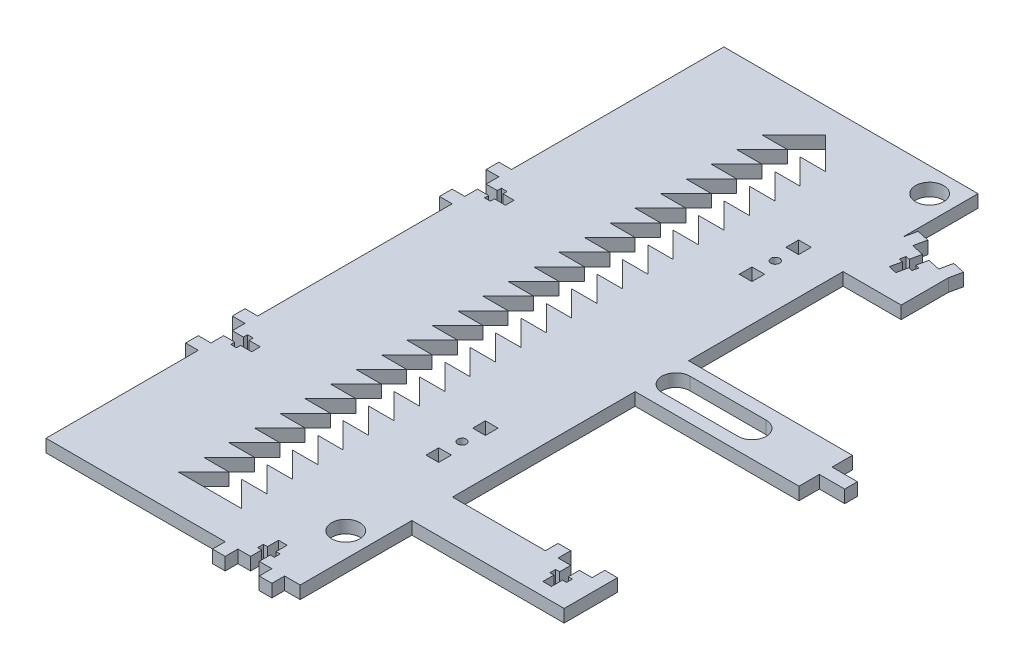
from build123d import *

# Parameters (mm, degrees)
AXLE_SUPPORT_PLATE_W   = 6.35
AXLE_SUPPORT_PLATE_H   = 6.35
AXLE_SUPPORT_PLATE_R   = 2.159
AXLE_SUPPORT_PLATE_R_2 = 7.030128061
BOSS_EXTRUDE1_DEPTH    = 6.35
BOSS_EXTRUDE2_DEPTH    = 6.35


with BuildPart() as part:
    # Axle Support Plate → Boss-Extrude1 (new body)
    with BuildSketch(Plane(origin=(0, 0, 0), x_dir=(1, 0, 0), z_dir=(0, 1, 0))):
        Polygon((55.79393597, -169.56756403), (63.58606403, -169.56756403), (63.58606403, -113.68756403), (139.78606403, -113.68756403), (139.78606403, -93.36756403), (139.78606403, -87.01756403), (133.43606403, -87.01756403), (133.43606403, -93.36756403), (127.08606403, -93.36756403), (127.08606403, -98.902564009), (129.127064012, -98.902564009), (129.127064012, -101.802564051), (127.08606403, -101.802564051), (127.08606403, -107.33756403), (122.76806403, -107.33756403), (122.76806403, -101.802564051), (120.727064048, -101.802564051), (120.727064048, -98.902564009), (122.76806403, -98.902564009), (122.76806403, -93.36756403), (116.41806403, -93.36756403), (116.41806403, -87.01756403), (110.06806403, -87.01756403), (110.06806403, -93.36756403), (63.58606403, -93.36756403), (63.58606403, -1.972692091), (145.546192091, -1.972692091), (145.546192091, 8.23243597), (158.246192091, 8.23243597), (158.246192091, 14.58243597), (145.546192091, 14.58243597), (145.546192091, 24.78756403), (63.58606403, 24.78756403), (63.58606403, 169.56756403), (-63.58606403, 169.56756403), (-63.58606403, 63.35043597), (-69.93606403, 63.35043597), (-69.93606403, 57.00043597), (-63.58606403, 57.00043597), (-63.58606403, 50.65043597), (-58.051064051, 50.65043597), (-58.051064051, 52.691435952), (-55.151064009, 52.691435952), (-55.151064009, 50.65043597), (-49.61606403, 50.65043597), (-49.61606403, 46.33243597), (-55.151064009, 46.33243597), (-55.151064009, 44.291435988), (-58.051064051, 44.291435988), (-58.051064051, 46.33243597), (-63.58606403, 46.33243597), (-63.58606403, 39.98243597), (-69.93606403, 39.98243597), (-69.93606403, 33.63243597), (-63.58606403, 33.63243597), (-63.58606403, -63.64956403), (-69.93606403, -63.64956403), (-69.93606403, -69.99956403), (-63.58606403, -69.99956403), (-63.58606403, -76.34956403), (-58.051064051, -76.34956403), (-58.051064051, -74.308564048), (-55.151064009, -74.308564048), (-55.151064009, -76.34956403), (-49.61606403, -76.34956403), (-49.61606403, -80.66756403), (-55.151064009, -80.66756403), (-55.151064009, -82.708564012), (-58.051064051, -82.708564012), (-58.051064051, -80.66756403), (-63.58606403, -80.66756403), (-63.58606403, -87.01756403), (-69.93606403, -87.01756403), (-69.93606403, -93.36756403), (-63.58606403, -93.36756403), (-63.58606403, -169.56756403), (26.07593597, -169.56756403), (26.07593597, -175.91756403), (32.42593597, -175.91756403), (32.42593597, -169.56756403), (38.77593597, -169.56756403), (38.77593597, -164.032564051), (36.734935988, -164.032564051), (36.734935988, -161.132564009), (38.77593597, -161.132564009), (38.77593597, -155.59756403), (43.09393597, -155.59756403), (43.09393597, -161.132564009), (45.134935952, -161.132564009), (45.134935952, -164.032564051), (43.09393597, -164.032564051), (43.09393597, -169.56756403), (49.44393597, -169.56756403), (49.44393597, -175.91756403), (55.79393597, -175.91756403), align=None)
        with Locations((41.95093597, -78.63556403)):
            Rectangle(AXLE_SUPPORT_PLATE_W, AXLE_SUPPORT_PLATE_H, mode=Mode.SUBTRACT)
        with Locations((41.95093597, -66.95156403)):
            Circle(AXLE_SUPPORT_PLATE_R, mode=Mode.SUBTRACT)
        with Locations((41.95093597, -55.26756403)):
            Rectangle(AXLE_SUPPORT_PLATE_W, AXLE_SUPPORT_PLATE_H, mode=Mode.SUBTRACT)
        with Locations((51.47593597, -134.64256403)):
            Circle(AXLE_SUPPORT_PLATE_R_2, mode=Mode.SUBTRACT)
        Polygon((-15.875, 140.99256403), (0, 156.86756403), (15.875, 140.99256403), (3.175, 140.99256403), (15.875, 128.29256403), (3.175, 128.29256403), (15.875, 115.59256403), (3.175, 115.59256403), (15.875, 102.89256403), (3.175, 102.89256403), (15.875, 90.19256403), (3.175, 90.19256403), (15.875, 77.49256403), (3.175, 77.49256403), (15.875, 64.79256403), (3.175, 64.79256403), (15.875, 52.09256403), (3.175, 52.09256403), (15.875, 39.39256403), (3.175, 39.39256403), (15.875, 26.69256403), (3.175, 26.69256403), (15.875, 13.99256403), (3.175, 13.99256403), (15.875, 1.29256403), (3.175, 1.29256403), (15.875, -11.40743597), (3.175, -11.40743597), (15.875, -24.10743597), (3.175, -24.10743597), (15.875, -36.80743597), (3.175, -36.80743597), (15.875, -49.50743597), (3.175, -49.50743597), (15.875, -62.20743597), (3.175, -62.20743597), (15.875, -74.90743597), (3.175, -74.90743597), (15.875, -87.60743597), (3.175, -87.60743597), (15.875, -100.30743597), (3.175, -100.30743597), (15.875, -113.00743597), (3.175, -113.00743597), (15.875, -125.70743597), (3.175, -125.70743597), (15.875, -138.40743597), (3.175, -138.40743597), (15.875, -151.10743597), (-15.875, -151.10743597), (-3.175, -138.40743597), (-15.875, -138.40743597), (-3.175, -125.70743597), (-15.875, -125.70743597), (-3.175, -113.00743597), (-15.875, -113.00743597), (-3.175, -100.30743597), (-15.875, -100.30743597), (-3.175, -87.60743597), (-15.875, -87.60743597), (-3.175, -74.90743597), (-15.875, -74.90743597), (-3.175, -62.20743597), (-15.875, -62.20743597), (-3.175, -49.50743597), (-15.875, -49.50743597), (-3.175, -36.80743597), (-15.875, -36.80743597), (-3.175, -24.10743597), (-15.875, -24.10743597), (-3.175, -11.40743597), (-15.875, -11.40743597), (-3.175, 1.29256403), (-15.875, 1.29256403), (-3.175, 13.99256403), (-15.875, 13.99256403), (-3.175, 26.69256403), (-15.875, 26.69256403), (-3.175, 39.39256403), (-15.875, 39.39256403), (-3.175, 52.09256403), (-15.875, 52.09256403), (-3.175, 64.79256403), (-15.875, 64.79256403), (-3.175, 77.49256403), (-15.875, 77.49256403), (-3.175, 90.19256403), (-15.875, 90.19256403), (-3.175, 102.89256403), (-15.875, 102.89256403), (-3.175, 115.59256403), (-15.875, 115.59256403), (-3.175, 128.29256403), (-15.875, 128.29256403), (-3.175, 140.99256403), align=None, mode=Mode.SUBTRACT)
        with Locations((41.95093597, 78.08243597)):
            Rectangle(AXLE_SUPPORT_PLATE_W, AXLE_SUPPORT_PLATE_H, mode=Mode.SUBTRACT)
        with Locations((41.95093597, 89.76643597)):
            Circle(AXLE_SUPPORT_PLATE_R, mode=Mode.SUBTRACT)
        with Locations((41.95093597, 101.45043597)):
            Rectangle(AXLE_SUPPORT_PLATE_W, AXLE_SUPPORT_PLATE_H, mode=Mode.SUBTRACT)
        with BuildLine():
            ThreePointArc((70.616192091, 4.377307909), (63.58606403, 11.40743597), (70.616192091, 18.43756403))
            Line((70.616192091, 18.43756403), (108.716192091, 18.43756403))
            ThreePointArc((108.716192091, 18.43756403), (115.746320151, 11.40743597), (108.716192091, 4.377307909))
            Line((108.716192091, 4.377307909), (70.616192091, 4.377307909))
        make_face(mode=Mode.SUBTRACT)
        with Locations((51.47593597, 157.45743597)):
            Circle(AXLE_SUPPORT_PLATE_R_2, mode=Mode.SUBTRACT)
    extrude(amount=BOSS_EXTRUDE1_DEPTH)

    # Sketch1 → Boss-Extrude2 (add)
    with BuildSketch(Plane(origin=(0, 6.35, 0), x_dir=(1, 0, 0), z_dir=(0, 1, 0))):
        Polygon((92.62282905, 102.084752853), (92.62282905, 125.730841214), (93.974665536, 131.935278184), (87.770228566, 133.28711467), (86.41839208, 127.0826777), (80.21395511, 128.434514187), (79.035622051, 123.026394738), (81.029835554, 122.591891077), (80.412461402, 119.758368641), (78.418247899, 120.192872301), (77.23991484, 114.784752853), (73.0208977, 115.704001663), (74.199230759, 121.112121112), (72.205017256, 121.546624772), (72.822391408, 124.380147209), (74.816604911, 123.945643549), (75.99493797, 129.353762997), (69.790501, 130.705599483), (71.142337487, 136.910036453), (64.937900517, 138.26187294), (63.58606403, 132.05743597), (63.58606403, 102.084752853), align=None)
    extrude(amount=-BOSS_EXTRUDE2_DEPTH)


solid = part.part
